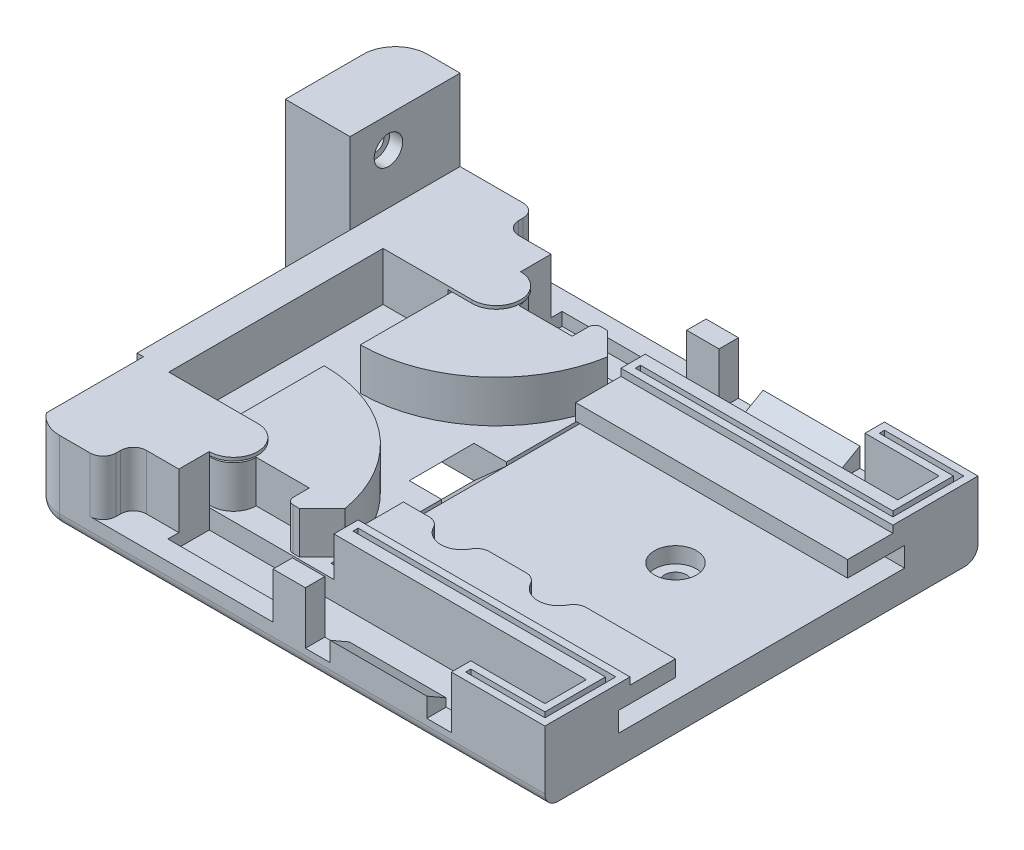
from build123d import *

# Parameters (mm, degrees)
SKETCH1_R            = 2.25
BOSS_EXTRUDE1_DEPTH  = 7.5
SKETCH2_W            = 80
SKETCH2_H            = 33.45
BOSS_EXTRUDE2_DEPTH  = 5
SKETCH3_W            = 19.25
SKETCH3_H            = 7.5
CUT_EXTRUDE1_DEPTH   = 3
SKETCH4_W            = 58.25
SKETCH4_H            = 6.4
CUT_EXTRUDE2_DEPTH   = 3
SKETCH5_W            = 7
SKETCH5_H            = 2.5
BOSS_EXTRUDE3_DEPTH  = 42
SKETCH6_W            = 44.4
SKETCH6_H            = 20.3
CUT_EXTRUDE3_DEPTH   = 0.55
BOSS_EXTRUDE4_START  = 0.1
SKETCH7_R            = 2.6
BOSS_EXTRUDE4_DEPTH  = 6.5
BOSS_EXTRUDE5_START  = -0.5
BOSS_EXTRUDE5_DEPTH  = 0.5
SKETCH9_W            = 7
SKETCH9_H            = 4.7
CUT_EXTRUDE4_DEPTH   = 7.5
CUT_EXTRUDE5_DEPTH   = 1
FILLET2_R            = 2
FILLET3_R            = 1
CUT_EXTRUDE11_DEPTH  = 5
CUT_EXTRUDE12_DEPTH  = 14.95
SKETCH17_W           = 42
SKETCH17_H           = 13.15
CUT_EXTRUDE13_DEPTH  = 1.4
CUT_EXTRUDE14_DEPTH  = 1.7
SKETCH19_R           = 3.25
SKETCH19_R_2         = 1.7
CUT_EXTRUDE15_DEPTH  = 3
SKETCH20_R           = 1.7
CUT_EXTRUDE16_DEPTH  = 105.596426803
SKETCH26_W           = 10
SKETCH26_H           = 17
BOSS_EXTRUDE11_DEPTH = 25
SKETCH32_W           = 17
SKETCH32_H           = 12.5
BOSS_EXTRUDE12_DEPTH = 3.4
FILLET13_R           = 5
FILLET14_R           = 5
LONG_SIDE_FILLET_1_R = 2
LONG_SIDE_FILLET_2_R = 2
CUT_EXTRUDE17_START  = -12.5
CUT_EXTRUDE17_DEPTH  = 12.232050808
CUT_EXTRUDE18_REACH  = 115.911
SKETCH41_W           = 44.2
SKETCH41_H           = 3.05
CUT_EXTRUDE19_START  = 5
SKETCH19_4_R         = 3.25
SKETCH19_4_R_2       = 1.7
CUT_EXTRUDE19_DEPTH  = 5
FILLET15_R           = 2


# Read off the part's stored shape, not the designer's step: Cut-Extrude17
with BuildPart() as part:
    # Sketch1 → Boss-Extrude1 (new body)
    with BuildSketch(Plane(origin=(0, 0, 0), x_dir=(1, 0, 0), z_dir=(0, 1, 0))):
        with BuildLine():
            Line((5, 16.9), (5, 33.45))
            Line((5, 33.45), (0, 33.45))
            Line((0, 33.45), (0, 0))
            Line((0, 0), (80, 0))
            Line((80, 0), (80, 9.4))
            Line((80, 9.4), (77, 9.4))
            Line((77, 9.4), (77, 3))
            Line((77, 3), (18.75, 3))
            Line((18.75, 3), (18.75, 9.4))
            ThreePointArc((18.75, 9.4), (16.098349571, 10.498349571), (15, 13.15))
            Line((15, 13.15), (15, 16.9))
            Line((15, 16.9), (5, 16.9))
        make_face()
        with Locations(Location((18.75, 13.15, 0), (0, 0, 270))):
            Circle(SKETCH1_R)
        Polygon((80, 9.4), (80, 13.15), (38, 13.15), (38, 9.4), (77, 9.4), align=None)
    extrude(amount=BOSS_EXTRUDE1_DEPTH)

    # Sketch2 → Boss-Extrude2 (add)
    with BuildSketch(Plane(origin=(0, 0, 0), x_dir=(-1, 0, 0), z_dir=(0, -1, 0))):
        with Locations((-40, 16.725)):
            Rectangle(SKETCH2_W, SKETCH2_H)
    extrude(amount=BOSS_EXTRUDE2_DEPTH)

    # Sketch3 → Cut-Extrude1 (cut)
    with BuildSketch(Plane.XY):
        Polygon((65.55, 6.1), (43, 6.1), (43, -2), (46.8, -2), (46.8, 1.5), (61.75, 1.5), (61.75, -2), (65.55, -2), align=None)
        with Locations((28.375, 3.75)):
            Rectangle(SKETCH3_W, SKETCH3_H)
    extrude(amount=-CUT_EXTRUDE1_DEPTH, mode=Mode.SUBTRACT)

    # Sketch4 → Cut-Extrude2 (cut)
    with BuildSketch(Plane(origin=(0, 0, 0), x_dir=(1, 0, 0), z_dir=(0, 1, 0))):
        with Locations((47.875, 6.2)):
            Rectangle(SKETCH4_W, SKETCH4_H)
    extrude(amount=-CUT_EXTRUDE2_DEPTH, mode=Mode.SUBTRACT)

    # Sketch5 → Boss-Extrude3 (add)
    with BuildSketch(Plane(origin=(80, 0, 0), x_dir=(0, 0, -1), z_dir=(1, 0, 0))):
        with Locations((16.65, 3.75)):
            Rectangle(SKETCH5_W, SKETCH5_H)
    extrude(amount=-BOSS_EXTRUDE3_DEPTH)

    # Sketch6 → Cut-Extrude3 (cut)
    with BuildSketch(Plane(origin=(0, 0, 0), x_dir=(1, 0, 0), z_dir=(0, 1, 0))):
        with Locations((57.8, 23.3)):
            Rectangle(SKETCH6_W, SKETCH6_H)
    extrude(amount=-CUT_EXTRUDE3_DEPTH, mode=Mode.SUBTRACT)

    # Sketch8 → Boss-Extrude5 (add)
    with BuildSketch(Plane(origin=(0, 7.5, 0), x_dir=(1, 0, 0), z_dir=(0, 1, 0)).offset(BOSS_EXTRUDE5_START)):
        with BuildLine():
            Line((15, 16.9), (15, 13.15))
            ThreePointArc((15, 13.15), (21.401650429, 10.498349571), (18.75, 16.9))
            Line((18.75, 16.9), (15, 16.9))
        make_face()
    extrude(amount=BOSS_EXTRUDE5_DEPTH)

    # Sketch9 → Cut-Extrude4 (cut)
    with BuildSketch(Plane(origin=(0, 7.5, 0), x_dir=(1, 0, 0), z_dir=(0, 1, 0))):
        with Locations((15.25, 2.35)):
            Rectangle(SKETCH9_W, SKETCH9_H)
    extrude(amount=-CUT_EXTRUDE4_DEPTH, mode=Mode.SUBTRACT)

    # Sketch10 → Cut-Extrude5 (cut)
    with BuildSketch(Plane(origin=(0, 0, 0), x_dir=(1, 0, 0), z_dir=(0, 1, 0))):
        Polygon((18.75, 4.7), (18.75, 3), (38, 3), (38, 0), (11.75, 0), (11.75, 4.7), align=None)
    extrude(amount=-CUT_EXTRUDE5_DEPTH, mode=Mode.SUBTRACT)

    # Fillet2
    fillet2_edges = [part.edges().sort_by_distance(p)[0] for p in [
        (11.75, 3.25, -4.7),
        (11.75, 3.25, 0),
    ]]
    fillet(fillet2_edges, radius=FILLET2_R)

    # Sketch15 → Cut-Extrude11 (cut)
    with BuildSketch(Plane(origin=(0, 0, -33.45), x_dir=(-1, 0, 0), z_dir=(0, 0, -1))):
        Polygon((-30.6, 0), (-35.6, 0), (-35.6, -0.55), (-30.6, -5), (-25.6, -5), (-28.6, -2), align=None)
        Polygon((0, -2), (-28.6, -2), (-25.6, -5), (0, -5), align=None)
    extrude(amount=-CUT_EXTRUDE11_DEPTH, mode=Mode.SUBTRACT)

    # Sketch16 → Cut-Extrude12 (cut)
    with BuildSketch(Plane.ZY.offset(-46.8)):
        Polygon((-3, -0.75), (0, 0.982050808), (0, 1.5), (-3, 1.5), align=None)
    extrude(amount=-CUT_EXTRUDE12_DEPTH, mode=Mode.SUBTRACT)

    # Sketch17 → Cut-Extrude13 (cut)
    with BuildSketch(Plane(origin=(0, 7.5, 0), x_dir=(1, 0, 0), z_dir=(0, 1, 0))):
        with Locations((59, 6.575)):
            Rectangle(SKETCH17_W, SKETCH17_H)
    extrude(amount=-CUT_EXTRUDE13_DEPTH, mode=Mode.SUBTRACT)

    # Sketch18 → Cut-Extrude14 (cut)
    with BuildSketch(Plane(origin=(0, 6.1, 0), x_dir=(1, 0, 0), z_dir=(0, 1, 0))):
        Polygon((78.1, 11.25), (39.1, 11.25), (39.1, 12.05), (78.9, 12.05), (78.9, 1.1), (66.65, 1.1), (66.65, 1.9), (78.1, 1.9), align=None)
    extrude(amount=-CUT_EXTRUDE14_DEPTH, mode=Mode.SUBTRACT)

    # Mirror1: part across plane


with BuildPart() as body_2:
    # Sketch7 → Boss-Extrude4 (new body)
    with BuildSketch(Plane(origin=(0, 0, 0), x_dir=(1, 0, 0), z_dir=(0, 1, 0)).offset(BOSS_EXTRUDE4_START)):
        with BuildLine():
            Line((15.25, 30.65), (15.25, 13.15))
            ThreePointArc((15.25, 13.15), (18.75, 9.65), (22.25, 13.15))
            Line((22.25, 13.15), (30.456279241, 13.15))
            Line((30.456279241, 13.15), (30.456279241, 9.65))
            Line((30.456279241, 9.65), (32.456279241, 9.65))
            Line((32.456279241, 9.65), (35.956279241, 13.15))
            ThreePointArc((35.956279241, 13.15), (28.805441712, 25.689014932), (15.25, 30.65))
        make_face()
        with Locations(Location((18.75, 13.15, 0), (0, 0, 90))):
            Circle(SKETCH7_R, mode=Mode.SUBTRACT)
    extrude(amount=BOSS_EXTRUDE4_DEPTH)

    # Fillet3
    fillet3_edges = [body_2.edges().sort_by_distance(p)[0] for p in [
        (30.456279241, 3.35, -9.65),
    ]]
    fillet(fillet3_edges, radius=FILLET3_R)


with BuildPart() as part_1:
    add(part.part)
    add(part.part.mirror(Plane(origin=(0, -5, -33.45), x_dir=(1, 0, 0), z_dir=(0, 0, 1))))

    # Sketch19 → Cut-Extrude15 (cut)
    # profile 1 of 8: a face of its own
    with BuildSketch(Plane(origin=(0, 0, 0), x_dir=(1, 0, 0), z_dir=(0, 1, 0))):
        with Locations(Location((18, 20.575, 0), (0, 0, 270))):
            Circle(SKETCH19_R)
        with Locations((18, 20.575)):
            Circle(SKETCH19_R_2, mode=Mode.SUBTRACT)
    # profile 2 of 8: a face of its own
    with BuildSketch(Plane(origin=(0, 0, 0), x_dir=(1, 0, 0), z_dir=(0, 1, 0))):
        with Locations((18, 20.575)):
            Circle(SKETCH19_R_2)
    # profile 3 of 8: a face of its own
    with BuildSketch(Plane(origin=(0, 0, 0), x_dir=(1, 0, 0), z_dir=(0, 1, 0))):
        with Locations(Location((61.6, 38.575, 0), (0, 0, 270))):
            Circle(SKETCH19_R)
        with Locations((61.6, 38.575)):
            Circle(SKETCH19_R_2, mode=Mode.SUBTRACT)
    # profile 4 of 8: a face of its own
    with BuildSketch(Plane(origin=(0, 0, 0), x_dir=(1, 0, 0), z_dir=(0, 1, 0))):
        with Locations((61.6, 38.575)):
            Circle(SKETCH19_R_2)
    # profile 5 of 8: a face of its own
    with BuildSketch(Plane(origin=(0, 0, 0), x_dir=(1, 0, 0), z_dir=(0, 1, 0))):
        with Locations(Location((61.6, 20.575, 0), (0, 0, 270))):
            Circle(SKETCH19_R)
        with Locations((61.6, 20.575)):
            Circle(SKETCH19_R_2, mode=Mode.SUBTRACT)
    # profile 6 of 8: a face of its own
    with BuildSketch(Plane(origin=(0, 0, 0), x_dir=(1, 0, 0), z_dir=(0, 1, 0))):
        with Locations((61.6, 20.575)):
            Circle(SKETCH19_R_2)
    # profile 7 of 8: a face of its own
    with BuildSketch(Plane(origin=(0, 0, 0), x_dir=(1, 0, 0), z_dir=(0, 1, 0))):
        with Locations(Location((46.6, 20.575, 0), (0, 0, 270))):
            Circle(SKETCH19_R)
        with Locations((46.6, 20.575)):
            Circle(SKETCH19_R_2, mode=Mode.SUBTRACT)
    # profile 8 of 8: a face of its own
    with BuildSketch(Plane(origin=(0, 0, 0), x_dir=(1, 0, 0), z_dir=(0, 1, 0))):
        with Locations((46.6, 20.575)):
            Circle(SKETCH19_R_2)
    extrude(amount=-CUT_EXTRUDE15_DEPTH, mode=Mode.SUBTRACT)

    # Sketch20 → Cut-Extrude16 (cut, through all)
    with BuildSketch(Plane(origin=(0, -0.55, 0), x_dir=(1, 0, 0), z_dir=(0, 1, 0))):
        with Locations(Location((46.6, 20.575, 0), (0, 0, 270))):
            Circle(SKETCH20_R)
        with Locations(Location((18, 20.575, 0), (0, 0, 270))):
            Circle(SKETCH20_R)
        with Locations(Location((61.6, 38.575, 0), (0, 0, 270))):
            Circle(SKETCH20_R)
        with Locations(Location((61.6, 20.575, 0), (0, 0, 270))):
            Circle(SKETCH20_R)
    extrude(amount=-CUT_EXTRUDE16_DEPTH, mode=Mode.SUBTRACT)

    # Sketch26 → Boss-Extrude11 (add)
    with BuildSketch(Plane(origin=(0, -5, 0), x_dir=(1, 0, 0), z_dir=(0, 1, 0))):
        with Locations((-5, 58.4)):
            Rectangle(SKETCH26_W, SKETCH26_H)
    extrude(amount=BOSS_EXTRUDE11_DEPTH)

    # Sketch32 → Boss-Extrude12 (add)
    with BuildSketch(Plane.ZY):
        with Locations((-58.4, 13.75)):
            Rectangle(SKETCH32_W, SKETCH32_H)
    extrude(amount=BOSS_EXTRUDE12_DEPTH)

    # Sketch39 → CBORE for M2 SHCS1 (revolve, cut)
    with BuildSketch(Plane(origin=(0, 15.2375, -55.825), x_dir=(0, 0, -1), z_dir=(0, 1, 0))):
        Polygon((0, 0), (0, 10), (1.3, 10), (1.3, 2), (2.2, 2), (2.2, 0), align=None)
    revolve(axis=Axis((6.35, 15.2375, -55.825), (-1, 0, 0)), mode=Mode.SUBTRACT)

    # Fillet13
    fillet13_edges = [part_1.edges().sort_by_distance(p)[0] for p in [
        (0, 1.25, 0),
    ]]
    fillet(fillet13_edges, radius=FILLET13_R)

    # Fillet14
    fillet14_edges = [part_1.edges().sort_by_distance(p)[0] for p in [
        (-10, 7.5, -66.9),
    ]]
    fillet(fillet14_edges, radius=FILLET14_R)

    # Long side fillet (1)
    long_side_fillet_1_edges = [part_1.edges().sort_by_distance(p)[0] for p in [
        (0, -5, -16.725),
        (1.464466094, -5, -1.464466094),
        (42.5, -5, 0),
    ]]
    fillet(long_side_fillet_1_edges, radius=LONG_SIDE_FILLET_1_R)

    # Long side fillet (2)
    long_side_fillet_2_edges = [part_1.edges().sort_by_distance(p)[0] for p in [
        (37.5, -5, -66.9),
        (-10, -5, -55.9),
        (-8.535533906, -5, -65.435533906),
    ]]
    fillet(long_side_fillet_2_edges, radius=LONG_SIDE_FILLET_2_R)

    # Cut-Extrude17 outline → Cut-Extrude17 (cut)
    with BuildSketch(Plane.XZ.offset(5).offset(CUT_EXTRUDE17_START)):
        with BuildLine():
            Line((1, -17), (1, -2))
            ThreePointArc((1, -2), (0.25658351, -3.41886117), (0, -5))
            Line((0, -5), (0, -17))
            Line((0, -17), (1, -17))
        make_face()
    extrude(amount=CUT_EXTRUDE17_DEPTH, mode=Mode.SUBTRACT)

    # Cut-Extrude18: up to this face of the body (flat: up to its plane)
    cut_extrude18_end = Plane(part_1.part.faces().sort_by_distance((35.6, -0.275, -20.8))[0])
    # Sketch41 → Cut-Extrude18 (cut, up to the picked face)
    with BuildSketch(Plane(origin=(80, 0, 0), x_dir=(0, 0, -1), z_dir=(1, 0, 0)), mode=Mode.PRIVATE) as cut_extrude18_sk1:
        with Locations((33.45, 0.975)):
            Rectangle(SKETCH41_W, SKETCH41_H)
    cut_extrude18_tool1 = split(extrude(cut_extrude18_sk1.sketch, amount=-CUT_EXTRUDE18_REACH, mode=Mode.PRIVATE), bisect_by=cut_extrude18_end, keep=Keep.BOTH, mode=Mode.PRIVATE)
    add(cut_extrude18_tool1.solids().sort_by(Axis((80, 0.975, -33.45), (-1, 0, 0)))[0], mode=Mode.SUBTRACT)

    # Sketch19<4> → Cut-Extrude19 (cut)
    # profile 1 of 4: a face of its own
    with BuildSketch(Plane(origin=(0, 0, 0), x_dir=(1, 0, 0), z_dir=(0, 1, 0)).offset(CUT_EXTRUDE19_START)):
        with Locations(Location((61.6, 20.575, 0), (0, 0, 270))):
            Circle(SKETCH19_4_R)
        with Locations(Location((61.6, 20.575, 0), (0, 0, 270))):
            Circle(SKETCH19_4_R_2, mode=Mode.SUBTRACT)
    # profile 2 of 4: a face of its own
    with BuildSketch(Plane(origin=(0, 0, 0), x_dir=(1, 0, 0), z_dir=(0, 1, 0)).offset(CUT_EXTRUDE19_START)):
        with Locations(Location((61.6, 20.575, 0), (0, 0, 270))):
            Circle(SKETCH19_4_R_2)
    # profile 3 of 4: a face of its own
    with BuildSketch(Plane(origin=(0, 0, 0), x_dir=(1, 0, 0), z_dir=(0, 1, 0)).offset(CUT_EXTRUDE19_START)):
        with Locations(Location((46.6, 20.575, 0), (0, 0, 270))):
            Circle(SKETCH19_4_R)
        with Locations(Location((46.6, 20.575, 0), (0, 0, 270))):
            Circle(SKETCH19_4_R_2, mode=Mode.SUBTRACT)
    # profile 4 of 4: a face of its own
    with BuildSketch(Plane(origin=(0, 0, 0), x_dir=(1, 0, 0), z_dir=(0, 1, 0)).offset(CUT_EXTRUDE19_START)):
        with Locations(Location((46.6, 20.575, 0), (0, 0, 270))):
            Circle(SKETCH19_4_R_2)
    extrude(amount=-CUT_EXTRUDE19_DEPTH, mode=Mode.SUBTRACT)

    # Fillet15
    fillet15_edges = [part_1.edges().sort_by_distance(p)[0] for p in [
        (64.822091712, 3.75, -20.15),
        (58.377908288, 3.75, -20.15),
        (49.822091712, 3.75, -20.15),
        (43.377908288, 3.75, -20.15),
    ]]
    fillet(fillet15_edges, radius=FILLET15_R)


with BuildPart() as body_3:
    # Mirror2: mirrored copy
    add(body_2.part.mirror(Plane.XY.offset(-33.45)))


solid = Compound([body_2.part, part_1.part, body_3.part])
